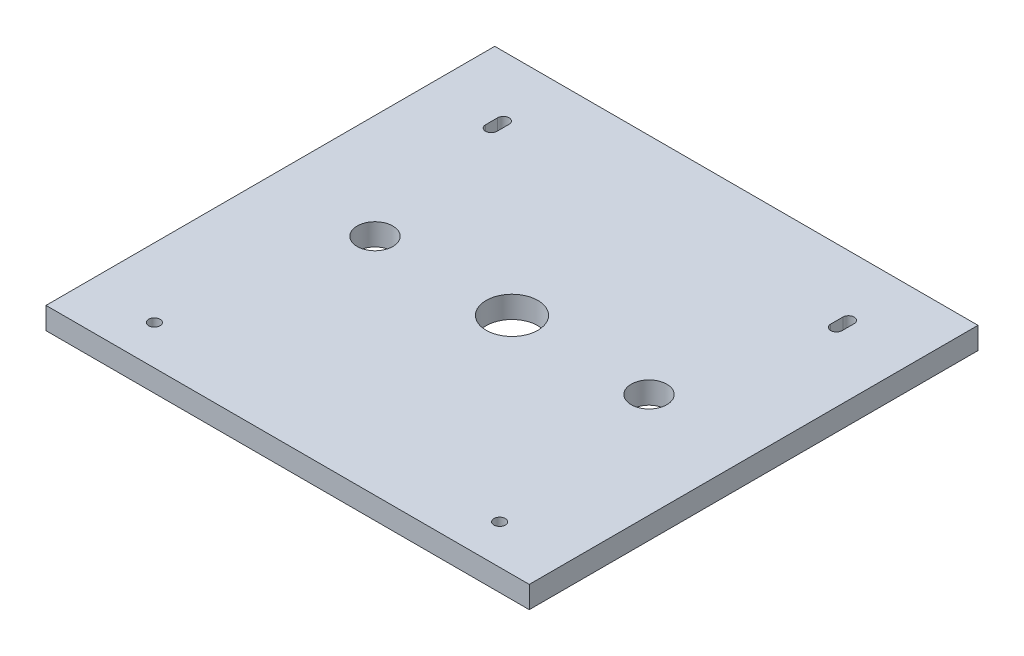
from build123d import *

# Parameters (mm, degrees)
SKETCH1_W           = 140
SKETCH1_H           = 130
BOSS_EXTRUDE1_DEPTH = 6.35
SKETCH2_R           = 1.65
SKETCH2_R_2         = 7.5
SKETCH2_R_3         = 5.16
CUT_EXTRUDE1_DEPTH  = 192.155231422


with BuildPart() as part:
    # Sketch1 → Boss-Extrude1 (new body)
    with BuildSketch(Plane(origin=(0, 0, 0), x_dir=(1, 0, 0), z_dir=(0, 1, 0))):
        with Locations((70, 65)):
            Rectangle(SKETCH1_W, SKETCH1_H)
    extrude(amount=BOSS_EXTRUDE1_DEPTH)

    # Sketch2 → Cut-Extrude1 (cut, through all)
    with BuildSketch(Plane(origin=(0, 6.35, 0), x_dir=(1, 0, 0), z_dir=(0, 1, 0))):
        with Locations((20, 11.41)):
            Circle(SKETCH2_R)
        with Locations((70, 65)):
            Circle(SKETCH2_R_2)
        with Locations((30.31, 65)):
            Circle(SKETCH2_R_3)
        with Locations((120, 11.41)):
            Circle(SKETCH2_R)
        with Locations((109.69, 65)):
            Circle(SKETCH2_R_3)
        with BuildLine():
            Line((18.35, 108.99), (18.35, 112.49))
            ThreePointArc((18.35, 112.49), (20, 114.14), (21.65, 112.49))
            Line((21.65, 112.49), (21.65, 108.99))
            ThreePointArc((21.65, 108.99), (20, 107.34), (18.35, 108.99))
        make_face()
        with BuildLine():
            Line((121.65, 108.99), (121.65, 112.49))
            ThreePointArc((121.65, 112.49), (120, 114.14), (118.35, 112.49))
            Line((118.35, 112.49), (118.35, 108.99))
            ThreePointArc((118.35, 108.99), (120, 107.34), (121.65, 108.99))
        make_face()
    extrude(amount=-CUT_EXTRUDE1_DEPTH, mode=Mode.SUBTRACT)


solid = part.part
